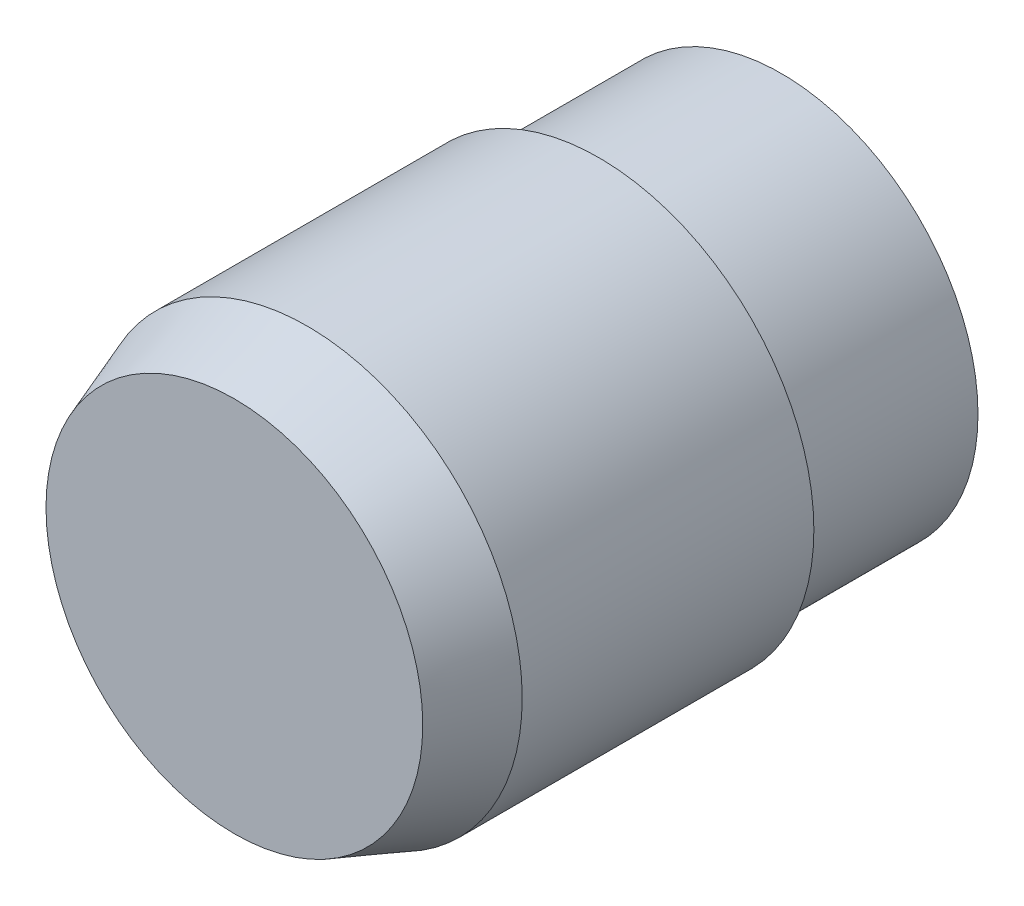
from build123d import *

# Parameters (mm, degrees)
SKETCH1_R           = 10.792449993
BOSS_EXTRUDE1_DEPTH = 10
SKETCH2_R           = 11.789355531
BOSS_EXTRUDE2_DEPTH = 20
CHAMFER1_SIZE       = 4
CHAMFER1_SIZE2      = 1.455880937


with BuildPart() as part:
    # Sketch1 → Boss-Extrude1 (new body)
    with BuildSketch(Plane.XY):
        Circle(SKETCH1_R)
    extrude(amount=BOSS_EXTRUDE1_DEPTH)

    # Sketch2 → Boss-Extrude2 (add)
    with BuildSketch(Plane.XY.offset(10)):
        Circle(SKETCH2_R)
    extrude(amount=BOSS_EXTRUDE2_DEPTH)

    # Chamfer1
    chamfer1_edges = [part.edges().sort_by_distance(p)[0] for p in [
        (-11.789355531, 0, 30),
    ]]
    chamfer1_side = [part.faces().sort_by_distance(p)[0] for p in [
        (-11.789355531, 0, 20),
    ]]
    chamfer(chamfer1_edges, length=CHAMFER1_SIZE, length2=CHAMFER1_SIZE2, reference=chamfer1_side[0])


solid = part.part
